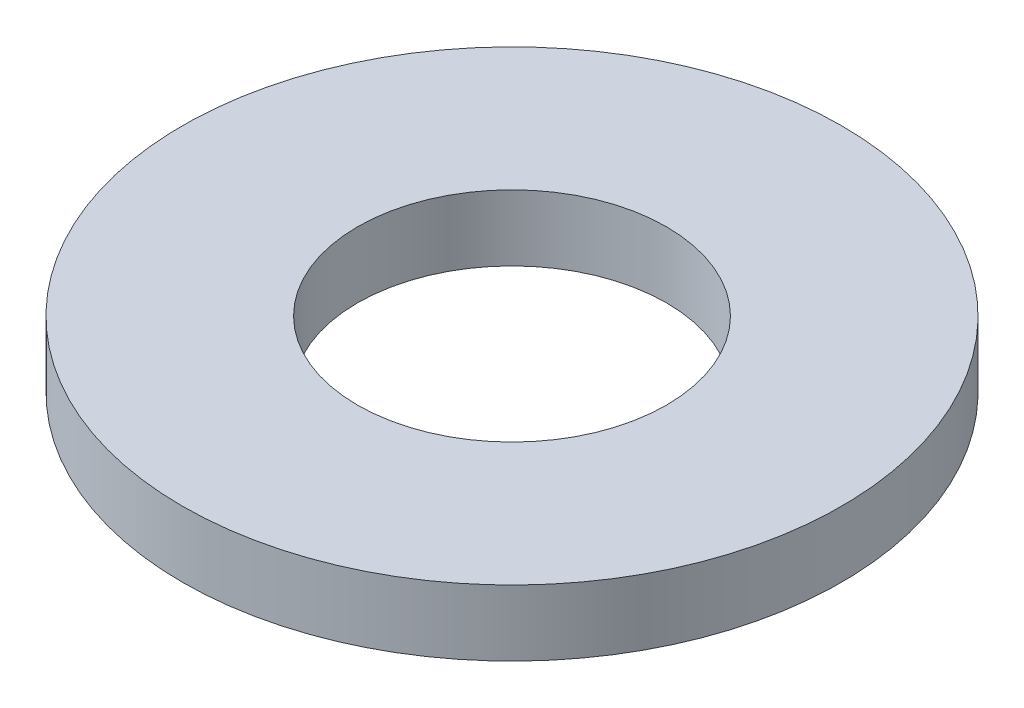
from build123d import *

# Parameters (mm, degrees)
SKETCH1_R           = 80
BOSS_EXTRUDE1_DEPTH = 16
SKETCH2_R           = 37.5
CUT_EXTRUDE1_DEPTH  = 115.262854857


with BuildPart() as part:
    # Sketch1 → Boss-Extrude1 (new body)
    with BuildSketch(Plane(origin=(0, 0, 0), x_dir=(1, 0, 0), z_dir=(0, 1, 0))):
        Circle(SKETCH1_R)
    extrude(amount=BOSS_EXTRUDE1_DEPTH)

    # Sketch2 → Cut-Extrude1 (cut, through all)
    with BuildSketch(Plane(origin=(0, 0, 0), x_dir=(1, 0, 0), z_dir=(0, 1, 0))):
        Circle(SKETCH2_R)
    extrude(amount=CUT_EXTRUDE1_DEPTH, mode=Mode.SUBTRACT)


solid = part.part
